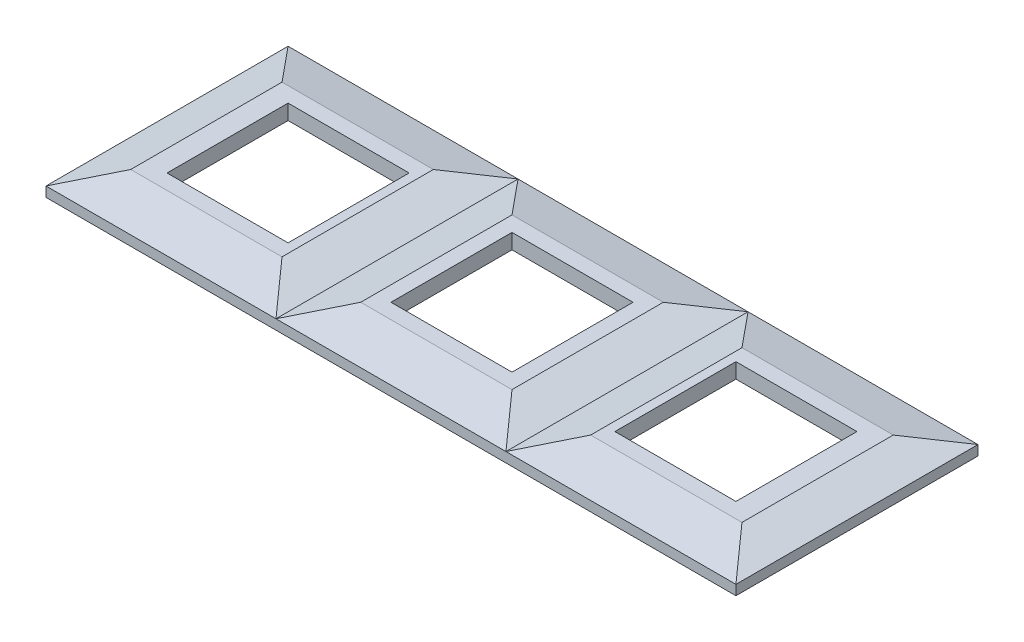
from build123d import *

# Parameters (mm, degrees)
EXTRUDE_1_DEPTH     = 40
SKETCH_2_OUTSIDE_W  = 130.346
SKETCH_2_OUTSIDE_H  = 57.346
CUT_EXTRUDE_1_DEPTH = 123
SKETCH_3_W          = 40
SKETCH_3_H          = 40
CUT_EXTRUDE_2_DEPTH = 122.016527797
SKETCH_4_W          = 71
SKETCH_4_H          = 71
CUT_EXTRUDE_3_DEPTH = 2


with BuildPart() as part:
    # Эскиз1 → Бобышка-Вытянуть1 (new, symmetric)
    with BuildSketch(Plane.XY):
        Polygon((-38, 0), (-114, 0), (-114, 3.277823138), (-101, 7), (-51, 7), (-38, 3.277823138), (-25, 7), (25, 7), (38, 3.277823138), (51, 7), (101, 7), (114, 3.277823138), (114, 0), (38, 0), align=None)
    extrude(amount=EXTRUDE_1_DEPTH, both=True)

    # Эскиз2 outside → Вырез-Вытянуть1 (cut, symmetric)
    with BuildSketch(Plane(origin=(0, 0, 0), x_dir=(0, 0, -1), z_dir=(1, 0, 0))):
        with Locations((0, 3.5)):
            Rectangle(SKETCH_2_OUTSIDE_W, SKETCH_2_OUTSIDE_H)
        Polygon((40, 0), (-40, 0), (-40, 3.277823138), (-25, 7), (25, 7), (40, 3.277823138), align=None, mode=Mode.SUBTRACT)
    extrude(amount=CUT_EXTRUDE_1_DEPTH, both=True, mode=Mode.SUBTRACT)

    # Эскиз3 → Вырез-Вытянуть2 (cut, through all)
    with BuildSketch(Plane.XZ):
        with Locations((74, 0)):
            Rectangle(SKETCH_3_W, SKETCH_3_H)
        Rectangle(SKETCH_3_W, SKETCH_3_H)
        with Locations((-74, 0)):
            Rectangle(SKETCH_3_W, SKETCH_3_H)
    extrude(amount=-CUT_EXTRUDE_2_DEPTH, mode=Mode.SUBTRACT)

    # Эскиз4 → Вырез-Вытянуть3 (cut)
    with BuildSketch(Plane.XZ):
        with Locations((74, 0)):
            Rectangle(SKETCH_4_W, SKETCH_4_H)
        Rectangle(SKETCH_4_W, SKETCH_4_H)
        with Locations((-74, 0)):
            Rectangle(SKETCH_4_W, SKETCH_4_H)
    extrude(amount=-CUT_EXTRUDE_3_DEPTH, mode=Mode.SUBTRACT)


solid = part.part
